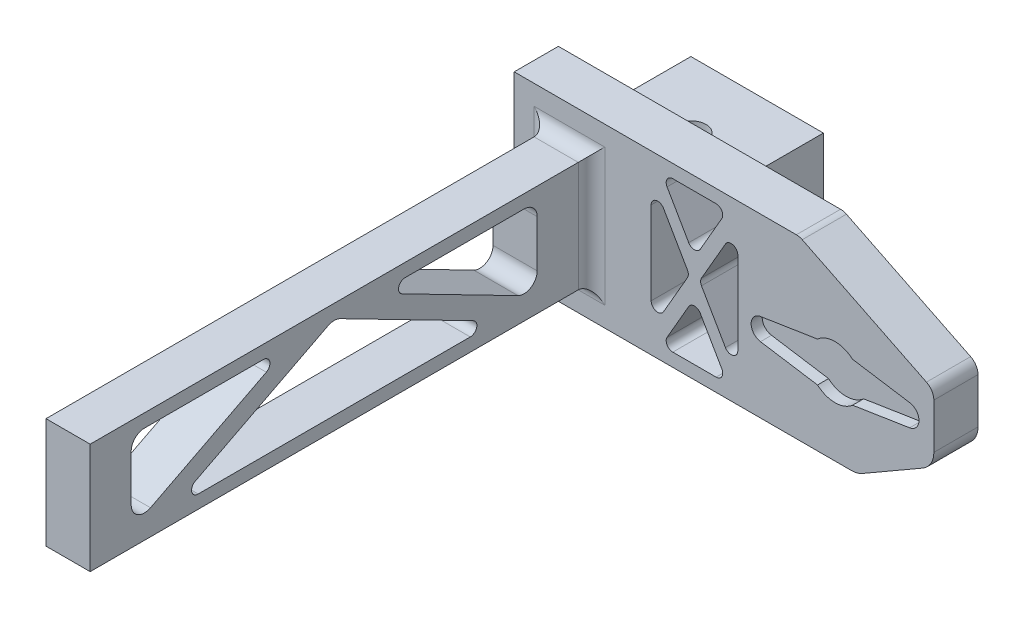
from build123d import *

# Parameters (mm, degrees)
SKETCH3_W             = 45
SKETCH3_H             = 15
BOSS_EXTRUDE1_DEPTH   = 10
CUT_EXTRUDE1_DEPTH    = 2.5
SKETCH11_W            = 45
SKETCH11_H            = 10
BOSS_EXTRUDE5_DEPTH   = 10
SKETCH14_W            = 45
SKETCH14_H            = 10
BOSS_EXTRUDE7_DEPTH   = 15
SKETCH20_W            = 10
SKETCH20_H            = 40
BOSS_EXTRUDE10_DEPTH  = 50
SKETCH21_W            = 10
SKETCH21_H            = 25
BOSS_EXTRUDE11_DEPTH  = 113.5
SKETCH22_W            = 30
SKETCH22_H            = 6
BOSS_EXTRUDE12_DEPTH  = 30
SKETCH23_W            = 30
SKETCH23_H            = 30
BOSS_EXTRUDE13_DEPTH  = 8.5
FILLET1_R             = 3
CHAMFER1_SIZE         = 15
CHAMFER1_SIZE2        = 30.41699103
FILLET2_R             = 3
CHAMFER2_SIZE         = 10
CHAMFER2_SIZE2        = 17.320508076
FILLET3_R             = 5
CUT_EXTRUDE2_DEPTH    = 146.077232094
FILLET4_R             = 3
FILLET5_R             = 1.5
M8_TAPPED_HOLE1_D     = 6.8
M8_TAPPED_HOLE1_DEPTH = 22.25
M8_TAPPED_HOLE1_TIP   = 2.042926105
CUT_EXTRUDE3_DEPTH    = 142.443451598
FILLET6_R             = 1.5


with BuildPart() as part:
    # Sketch3 → Boss-Extrude1 (new body)
    with BuildSketch(Plane.XY):
        with Locations((-0.138845539, 0.05888455)):
            Rectangle(SKETCH3_W, SKETCH3_H)
    extrude(amount=-BOSS_EXTRUDE1_DEPTH)

    # Sketch2 → Cut-Extrude1 (cut)
    with BuildSketch(Plane.XY):
        with BuildLine():
            Line((-16.888114198, 2.469689731), (-3.968626967, 4.5))
            ThreePointArc((-3.968626967, 4.5), (0, 6), (3.968626967, 4.5))
            Line((3.968626967, 4.5), (16.888114198, 2.469689731))
            ThreePointArc((16.888114198, 2.469689731), (19, 0), (16.888114198, -2.469689731))
            Line((16.888114198, -2.469689731), (3.968626967, -4.5))
            ThreePointArc((3.968626967, -4.5), (0, -6), (-3.968626967, -4.5))
            Line((-3.968626967, -4.5), (-16.888114198, -2.469689731))
            ThreePointArc((-16.888114198, -2.469689731), (-19, 0), (-16.888114198, 2.469689731))
        make_face()
    extrude(amount=-CUT_EXTRUDE1_DEPTH, mode=Mode.SUBTRACT)

    # Sketch11 → Boss-Extrude5 (add)
    with BuildSketch(Plane.XZ.offset(7.44111545)):
        with Locations((-0.138845539, -5)):
            Rectangle(SKETCH11_W, SKETCH11_H)
    extrude(amount=BOSS_EXTRUDE5_DEPTH)

    # Sketch14 → Boss-Extrude7 (add)
    with BuildSketch(Plane(origin=(0, 7.55888455, 0), x_dir=(1, 0, 0), z_dir=(0, 1, 0))):
        with Locations((-0.138845539, 5)):
            Rectangle(SKETCH14_W, SKETCH14_H)
    extrude(amount=BOSS_EXTRUDE7_DEPTH)

    # Sketch20 → Boss-Extrude10 (add)
    with BuildSketch(Plane.ZY.offset(22.638845539)):
        with Locations((-5, 2.55888455)):
            Rectangle(SKETCH20_W, SKETCH20_H)
    extrude(amount=BOSS_EXTRUDE10_DEPTH)

    # Sketch21 → Boss-Extrude11 (add)
    with BuildSketch(Plane.XY):
        with Locations((-60.138845539, 2.55888455)):
            Rectangle(SKETCH21_W, SKETCH21_H)
    extrude(amount=BOSS_EXTRUDE11_DEPTH)

    # Sketch22 → Boss-Extrude12 (add)
    with BuildSketch(Plane(origin=(0, 0, -10), x_dir=(-1, 0, 0), z_dir=(0, 0, -1))):
        with Locations((57.638845539, 2.55888455)):
            Rectangle(SKETCH22_W, SKETCH22_H)
    extrude(amount=BOSS_EXTRUDE12_DEPTH)

    # Sketch23 → Boss-Extrude13 (add)
    with BuildSketch(Plane.XZ.offset(0.44111545)):
        with Locations((-57.638845539, -25)):
            Rectangle(SKETCH23_W, SKETCH23_H)
    extrude(amount=BOSS_EXTRUDE13_DEPTH)

    # Fillet1
    fillet1_edges = [part.edges().sort_by_distance(p)[0] for p in [
        (-60.138845539, 15.05888455, 0),
        (-65.138845539, 2.55888455, 0),
        (-55.138845539, 2.55888455, 0),
        (-60.138845539, -9.94111545, 0),
    ]]
    fillet(fillet1_edges, radius=FILLET1_R)

    # Chamfer1
    chamfer1_edges = [part.edges().sort_by_distance(p)[0] for p in [
        (22.361154461, 22.55888455, -5),
    ]]
    chamfer1_side = [part.faces().sort_by_distance(p)[0] for p in [
        (22.361154461, 2.55888455, -5),
    ]]
    chamfer(chamfer1_edges, length=CHAMFER1_SIZE, length2=CHAMFER1_SIZE2, reference=chamfer1_side[0])

    # Fillet2
    fillet2_edges = [part.edges().sort_by_distance(p)[0] for p in [
        (-8.055836569, 22.55888455, -5),
        (22.361154461, 7.55888455, -5),
    ]]
    fillet(fillet2_edges, radius=FILLET2_R)

    # Chamfer2
    chamfer2_edges = [part.edges().sort_by_distance(p)[0] for p in [
        (22.361154461, -17.44111545, -5),
    ]]
    chamfer2_side = [part.faces().sort_by_distance(p)[0] for p in [
        (22.361154461, -5.873875391, -5),
    ]]
    chamfer(chamfer2_edges, length=CHAMFER2_SIZE, length2=CHAMFER2_SIZE2, reference=chamfer2_side[0])

    # Fillet3
    fillet3_edges = [part.edges().sort_by_distance(p)[0] for p in [
        (5.040646385, -17.44111545, -5),
        (22.361154461, -7.44111545, -5),
    ]]
    fillet(fillet3_edges, radius=FILLET3_R)

    # Sketch24 → Cut-Extrude2 (cut, through all)
    with BuildSketch(Plane.ZY.offset(65.138845539)):
        Polygon((58.25, -6.94111545), (95.25, -6.94111545), (58.25, 12.05888455), (21.25, -6.94111545), align=None)
        Polygon((48.39896268, 12.05888455), (12.290027833, -6.483541453), (12.290027833, 12.05888455), align=None)
        Polygon((68.10103732, 12.05888455), (104.209972167, 12.05888455), (104.209972167, -6.483541453), align=None)
    extrude(amount=-CUT_EXTRUDE2_DEPTH, mode=Mode.SUBTRACT)

    # Fillet4
    fillet4_edges = [part.edges().sort_by_distance(p)[0] for p in [
        (-60.138845539, -6.483541453, 12.290027833),
        (-60.138845539, 12.05888455, 12.290027833),
        (-60.138845539, -6.483541453, 104.209972167),
        (-60.138845539, 12.05888455, 104.209972167),
        (-60.138845539, 12.05888455, 58.25),
    ]]
    fillet(fillet4_edges, radius=FILLET4_R)

    # Fillet5
    fillet5_edges = [part.edges().sort_by_distance(p)[0] for p in [
        (-60.138845539, 12.05888455, 68.10103732),
        (-60.138845539, -6.94111545, 95.25),
        (-60.138845539, -6.94111545, 21.25),
        (-60.138845539, 12.05888455, 48.39896268),
    ]]
    fillet(fillet5_edges, radius=FILLET5_R)

    # M8 Tapped Hole1
    with Locations(Plane(origin=(0, 5.55888455, 0), x_dir=(1, 0, 0), z_dir=(0, 1, 0))):
        with Locations((-57.638845539, 25)):
            Hole(M8_TAPPED_HOLE1_D / 2, depth=M8_TAPPED_HOLE1_DEPTH)
            with Locations((0, 0, -(M8_TAPPED_HOLE1_DEPTH + M8_TAPPED_HOLE1_TIP / 2))):  # 118° drill point
                Cone(0, M8_TAPPED_HOLE1_D / 2, M8_TAPPED_HOLE1_TIP, mode=Mode.SUBTRACT)

    # Sketch32 → Cut-Extrude3 (cut, through all)
    with BuildSketch(Plane(origin=(-42.638845539, 5.55888455, -10), x_dir=(1, 0, 0), z_dir=(0, 0, 1))):
        Polygon((10.809559843, 14), (3.309559843, 14), (10.809559843, 1.002474929), (18.309559843, 14), align=None)
        Polygon((1, 12), (9.65549398, -3), (1, -18), (1, -3), align=None)
        Polygon((10.809559843, -7.002474929), (18.309559843, -20), (10.809559843, -20), (3.309559843, -20), align=None)
        Polygon((20.619119687, -18), (20.619119687, -3), (20.619119687, 12), (11.963625707, -3), align=None)
    extrude(amount=CUT_EXTRUDE3_DEPTH, mode=Mode.SUBTRACT)

    # Fillet6
    fillet6_edges = [part.edges().sort_by_distance(p)[0] for p in [
        (-41.638845539, 17.55888455, -5),
        (-31.829285696, 6.561359479, -5),
        (-39.329285696, 19.55888455, -5),
        (-24.329285696, 19.55888455, -5),
        (-22.019725852, -12.44111545, -5),
        (-22.019725852, 17.55888455, -5),
        (-30.675219832, 2.55888455, -5),
        (-39.329285696, -14.44111545, -5),
        (-24.329285696, -14.44111545, -5),
        (-31.829285696, -1.44359038, -5),
        (-41.638845539, -12.44111545, -5),
        (-32.98335156, 2.55888455, -5),
    ]]
    fillet(fillet6_edges, radius=FILLET6_R)


solid = part.part
